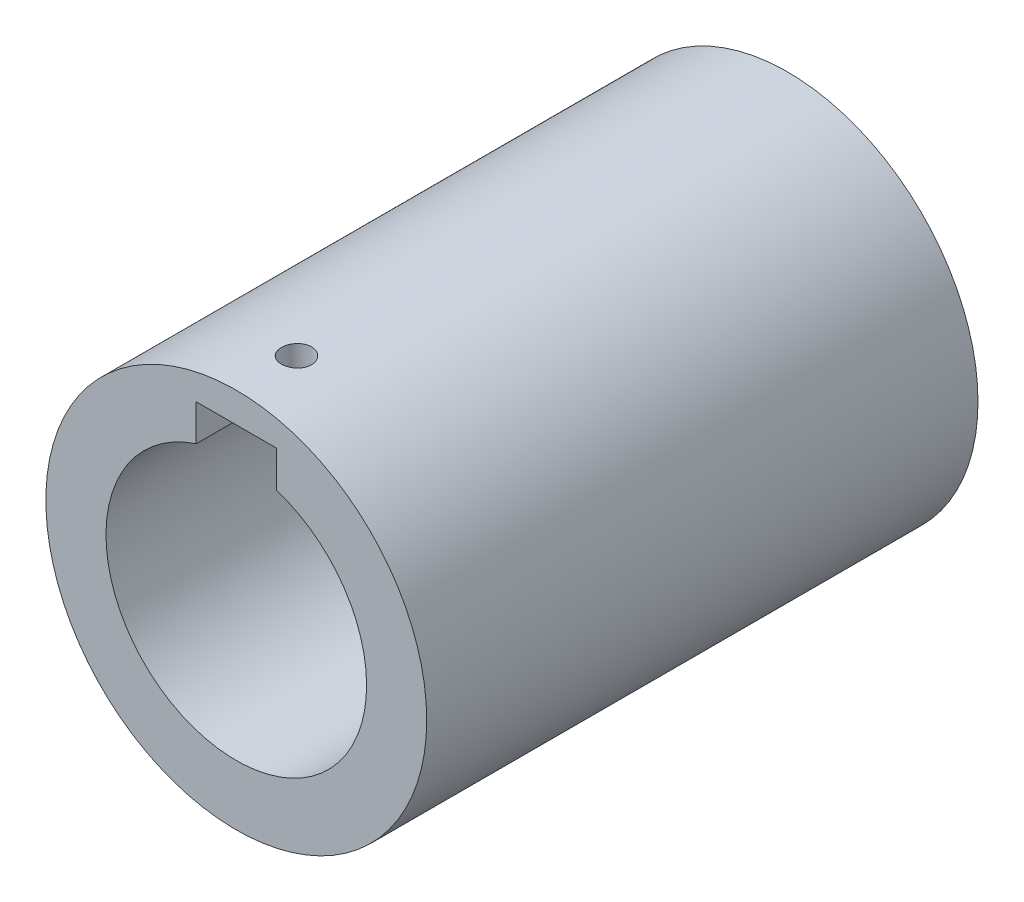
from build123d import *

# Parameters (mm, degrees)
SKETCH1_R           = 19
SKETCH1_R_2         = 13
BOSS_EXTRUDE1_DEPTH = 55
SKETCH2_W           = 8
SKETCH2_H           = 6
CUT_EXTRUDE3_DEPTH  = 24
FILLET5_R           = 4
FILLET6_R           = 4
SKETCH3_R           = 1.5
CUT_EXTRUDE11_DEPTH = 68.904344566


with BuildPart() as part:
    # Sketch1 → Boss-Extrude1 (new body)
    with BuildSketch(Plane.XY):
        Circle(SKETCH1_R)
        Circle(SKETCH1_R_2, mode=Mode.SUBTRACT)
    extrude(amount=BOSS_EXTRUDE1_DEPTH)

    # Sketch2 → Cut-Extrude3 (cut)
    with BuildSketch(Plane.XY.offset(55)):
        with Locations((0, 13)):
            Rectangle(SKETCH2_W, SKETCH2_H)
    extrude(amount=-CUT_EXTRUDE3_DEPTH, mode=Mode.SUBTRACT)

    # Fillet5
    fillet5_edges = [part.edges().sort_by_distance(p)[0] for p in [
        (4, 14.184658438, 31),
    ]]
    fillet(fillet5_edges, radius=FILLET5_R)

    # Fillet6
    fillet6_edges = [part.edges().sort_by_distance(p)[0] for p in [
        (-4, 14.184658438, 31),
    ]]
    fillet(fillet6_edges, radius=FILLET6_R - 0.0001)  # a hair under: the kernel refuses the full size

    # Sketch3 → Cut-Extrude11 (cut, through all)
    with BuildSketch(Plane(origin=(0, 16, 0), x_dir=(-1, 0, 0), z_dir=(0, -1, 0))):
        with Locations(Location((0, -49, 0), (0, 0, 90))):
            Circle(SKETCH3_R)
    extrude(amount=-CUT_EXTRUDE11_DEPTH, mode=Mode.SUBTRACT)


solid = part.part
